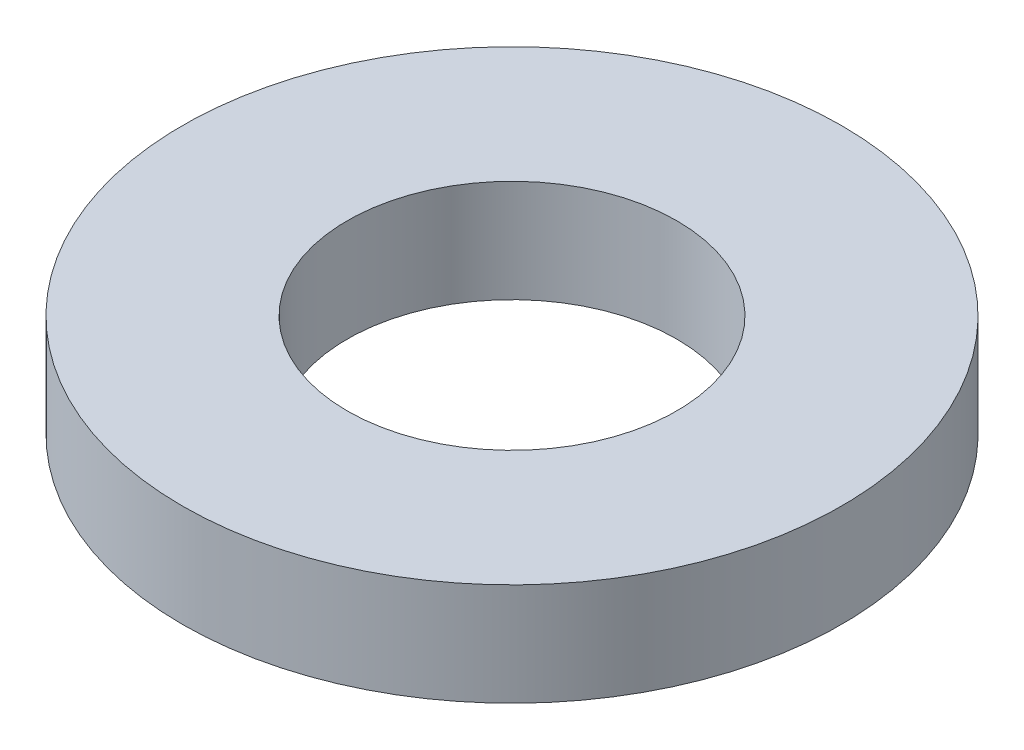
from build123d import *

# Parameters (mm, degrees)
SKETCH1_R           = 45
BOSS_EXTRUDE1_DEPTH = 14
SKETCH2_R           = 22.5
CUT_EXTRUDE1_DEPTH  = 66.161338231


with BuildPart() as part:
    # Sketch1 → Boss-Extrude1 (new body)
    with BuildSketch(Plane(origin=(0, 0, 0), x_dir=(1, 0, 0), z_dir=(0, 1, 0))):
        Circle(SKETCH1_R)
    extrude(amount=BOSS_EXTRUDE1_DEPTH)

    # Sketch2 → Cut-Extrude1 (cut, through all)
    with BuildSketch(Plane(origin=(0, 0, 0), x_dir=(1, 0, 0), z_dir=(0, 1, 0))):
        Circle(SKETCH2_R)
    extrude(amount=CUT_EXTRUDE1_DEPTH, mode=Mode.SUBTRACT)


solid = part.part
